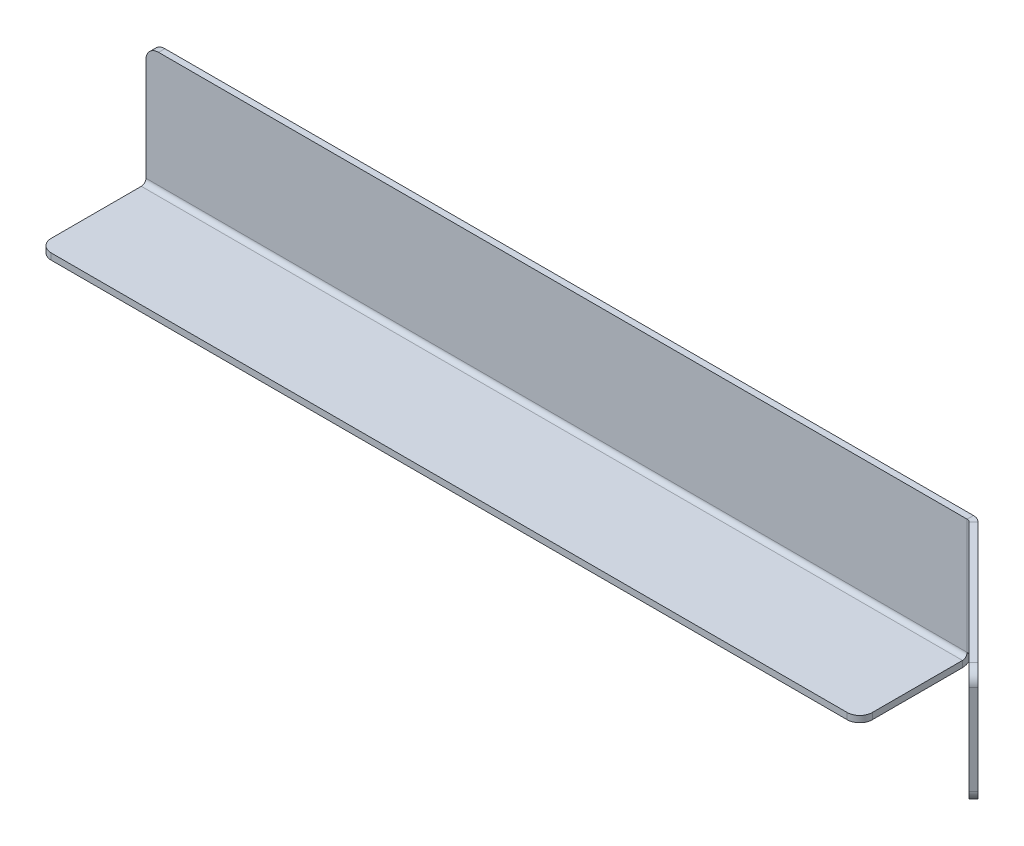
from build123d import *

# Parameters (mm, degrees)
SKETCH2_W                    = 130
SKETCH2_H                    = 20
BASE_FLANGE1_DEPTH           = 1
EDGE_FLANGE1_STRIP_W         = 5.4732
EDGE_FLANGE1_STRIP_H         = 1
EDGE_FLANGE1_STRIP_CUT_DEPTH = 130
EDGE_FLANGE1_DEPTH           = 130
EDGE_FLANGE2_DEPTH           = 18.2634
FILLET1_R                    = 2


# Sheet-metal steps are written as plain solids
with BuildPart() as part:
    # Sketch2 → Base-Flange1 (new body)
    with BuildSketch(Plane.XY):
        with Locations((-65, 10)):
            Rectangle(SKETCH2_W, SKETCH2_H)
    extrude(amount=-BASE_FLANGE1_DEPTH)

    # Edge-Flange1 strip (across the edge) → Edge-Flange1 strip cut (cut)
    with BuildSketch(Plane.YZ.offset(-130)):
        with Locations((-1, -0.5)):
            Rectangle(EDGE_FLANGE1_STRIP_W, EDGE_FLANGE1_STRIP_H)
    extrude(amount=EDGE_FLANGE1_STRIP_CUT_DEPTH, mode=Mode.SUBTRACT)

    # Edge-Flange1 section (across the edge) → Edge-Flange1 (add)
    with BuildSketch(Plane.YZ.offset(-130)):
        with BuildLine():
            Line((0, 0.7366), (0, 17))
            Line((0, 17), (1, 17))
            Line((1, 17), (1, 0.7366))
            ThreePointArc((1, 0.7366), (1.215745145, 0.215745145), (1.7366, 0))
            Line((1.7366, 0), (1.7366, -1))
            ThreePointArc((1.7366, -1), (0.508638364, -0.491361636), (0, 0.7366))
        make_face()
    extrude(amount=EDGE_FLANGE1_DEPTH)

    # Edge-Flange2 section (across the edge) → Edge-Flange2 (add)
    with BuildSketch(Plane(origin=(0.30510971, 1.7366, 0), x_dir=(-0.7071067811865438, 0, 0.7071067811865512), z_dir=(0, 1, 0))):
        with BuildLine():
            Line((-1, 0.30510971), (-1, 29.585786438))
            Line((-1, 29.585786438), (0, 29.585786438))
            Line((0, 29.585786438), (0, 0.30510971))
            ThreePointArc((0, 0.30510971), (0.056070336, 0.023225094), (0.215745145, -0.215745145))
            Line((0.215745145, -0.215745145), (-0.491361636, -0.922851926))
            ThreePointArc((-0.491361636, -0.922851926), (-0.867809196, -0.359458339), (-1, 0.30510971))
        make_face()
    extrude(amount=EDGE_FLANGE2_DEPTH)

    # Fillet1
    fillet1_edges = [part.edges().sort_by_distance(p)[0] for p in [
        (-130, 0.5, 17),
        (0, 0.5, 17),
        (21.578973317, 1.7366, 20.566756826),
        (21.578973317, 20, 20.566756826),
        (-130, 20, -0.5),
    ]]
    fillet(fillet1_edges, radius=FILLET1_R)


solid = part.part
